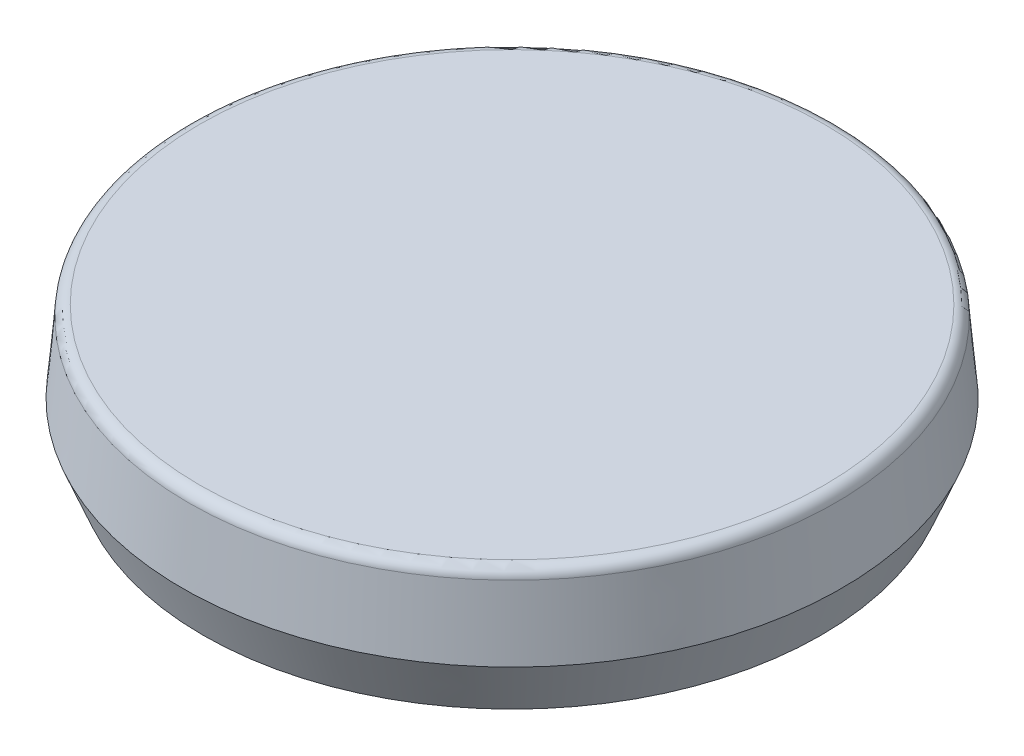
from build123d import *

# Parameters (mm, degrees)
FILLET1_R          = 0.1
SKETCH2_R          = 2.5
CUT_EXTRUDE1_DEPTH = 0.5


with BuildPart() as part:
    # Sketch1 → Revolve1 (revolve)
    with BuildSketch(Plane.XY):
        Polygon((0, 0), (0, 1.2), (2.935572642, 1.2), (3, 0.463591927), (2.812696703, 0), align=None)
    revolve(axis=Axis((0, 0, 0), (0, 1, 0)))

    # Fillet1
    fillet1_edges = [part.edges().sort_by_distance(p)[0] for p in [
        (-2.935572642, 1.2, 0),
    ]]
    fillet(fillet1_edges, radius=FILLET1_R)

    # Sketch2 → Cut-Extrude1 (cut)
    with BuildSketch(Plane.XZ):
        Circle(SKETCH2_R)
    extrude(amount=-CUT_EXTRUDE1_DEPTH, mode=Mode.SUBTRACT)


solid = part.part
